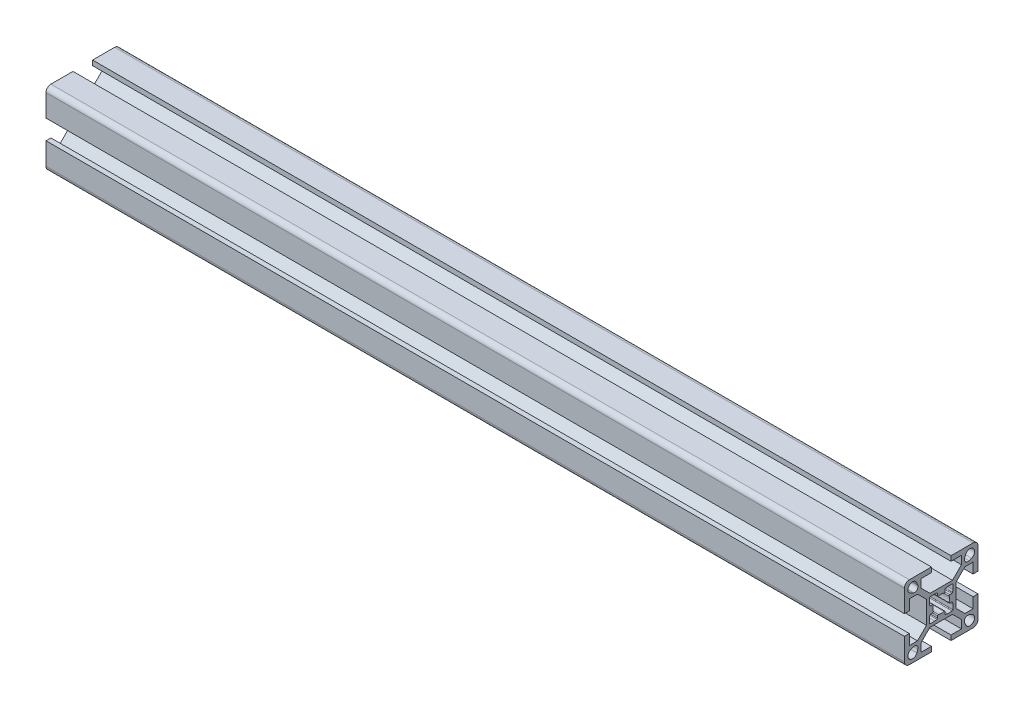
from build123d import *

# Parameters (mm, degrees)
BOSS_EXTRUDE1_DEPTH = 350


with BuildPart() as part:
    # Sketch1 → Boss-Extrude1 (new body)
    with BuildSketch(Plane(origin=(0, 0, 0), x_dir=(0, 0, -1), z_dir=(1, 0, 0))):
        with BuildLine():
            Line((-15, 13), (-15, 4))
            Line((-15, 4), (-13, 4))
            Line((-13, 4), (-13, 8.25))
            Line((-13, 8.25), (-9.664213562, 8.25))
            Line((-9.664213562, 8.25), (-6, 4.585786438))
            Line((-6, 4.585786438), (-6, -4.585786438))
            Line((-6, -4.585786438), (-9.664213562, -8.25))
            Line((-9.664213562, -8.25), (-13, -8.25))
            Line((-13, -8.25), (-13, -4))
            Line((-13, -4), (-15, -4))
            Line((-15, -4), (-15, -13))
            ThreePointArc((-15, -13), (-14.414213562, -14.414213562), (-13, -15))
            Line((-13, -15), (-4, -15))
            Line((-4, -15), (-4, -13))
            Line((-4, -13), (-8.25, -13))
            Line((-8.25, -13), (-8.25, -9.664213562))
            Line((-8.25, -9.664213562), (-4.585786438, -6))
            Line((-4.585786438, -6), (4.585786438, -6))
            Line((4.585786438, -6), (8.25, -9.664213562))
            Line((8.25, -9.664213562), (8.25, -13))
            Line((8.25, -13), (4, -13))
            Line((4, -13), (4, -15))
            Line((4, -15), (13, -15))
            ThreePointArc((13, -15), (14.414213562, -14.414213562), (15, -13))
            Line((15, -13), (15, -4))
            Line((15, -4), (13, -4))
            Line((13, -4), (13, -8.25))
            Line((13, -8.25), (9.664213562, -8.25))
            Line((9.664213562, -8.25), (6, -4.585786438))
            Line((6, -4.585786438), (6, 4.585786438))
            Line((6, 4.585786438), (9.664213562, 8.25))
            Line((9.664213562, 8.25), (13, 8.25))
            Line((13, 8.25), (13, 4))
            Line((13, 4), (15, 4))
            Line((15, 4), (15, 13))
            ThreePointArc((15, 13), (14.414213562, 14.414213562), (13, 15))
            Line((13, 15), (4, 15))
            Line((4, 15), (4, 13))
            Line((4, 13), (8.25, 13))
            Line((8.25, 13), (8.25, 9.664213562))
            Line((8.25, 9.664213562), (4.585786438, 6))
            Line((4.585786438, 6), (-4.585786438, 6))
            Line((-4.585786438, 6), (-8.25, 9.664213562))
            Line((-8.25, 9.664213562), (-8.25, 13))
            Line((-8.25, 13), (-4, 13))
            Line((-4, 13), (-4, 15))
            Line((-4, 15), (-13, 15))
            ThreePointArc((-13, 15), (-14.414213562, 14.414213562), (-15, 13))
        make_face()
        with BuildLine():
            Line((-9.539070071, 11.338915743), (-9.918883282, 12.361530981))
            ThreePointArc((-9.918883282, 12.361530981), (-13.043502884, 13.043502884), (-12.361530981, 9.918883282))
            Line((-12.361530981, 9.918883282), (-11.338915743, 9.539070071))
            ThreePointArc((-11.338915743, 9.539070071), (-9.861522369, 9.861522369), (-9.539070071, 11.338915743))
        make_face(mode=Mode.SUBTRACT)
        with BuildLine():
            Line((9.918883282, 12.361530981), (9.539070071, 11.338915743))
            ThreePointArc((9.539070071, 11.338915743), (9.861522369, 9.861522369), (11.338915743, 9.539070071))
            Line((11.338915743, 9.539070071), (12.361530981, 9.918883282))
            ThreePointArc((12.361530981, 9.918883282), (13.043502884, 13.043502884), (9.918883282, 12.361530981))
        make_face(mode=Mode.SUBTRACT)
        with BuildLine():
            Line((12.361530981, -9.918883282), (11.338915743, -9.539070071))
            ThreePointArc((11.338915743, -9.539070071), (9.861522369, -9.861522369), (9.539070071, -11.338915743))
            Line((9.539070071, -11.338915743), (9.918883282, -12.361530981))
            ThreePointArc((9.918883282, -12.361530981), (13.043502884, -13.043502884), (12.361530981, -9.918883282))
        make_face(mode=Mode.SUBTRACT)
        with BuildLine():
            Line((-11.338915743, -9.539070071), (-12.361530981, -9.918883282))
            ThreePointArc((-12.361530981, -9.918883282), (-13.043502884, -13.043502884), (-9.918883282, -12.361530981))
            Line((-9.918883282, -12.361530981), (-9.539070071, -11.338915743))
            ThreePointArc((-9.539070071, -11.338915743), (-9.861522369, -9.861522369), (-11.338915743, -9.539070071))
        make_face(mode=Mode.SUBTRACT)
        with BuildLine():
            Line((-4.8, -2.644433572), (-4.8, -4.5))
            ThreePointArc((-4.8, -4.5), (-4.712132034, -4.712132034), (-4.5, -4.8))
            Line((-4.5, -4.8), (-2.644433572, -4.8))
            ThreePointArc((-2.644433572, -4.8), (-2.615679847, -4.79861886), (-2.587190874, -4.794488155))
            Line((-2.587190874, -4.794488155), (-1.742757301, -4.630346896))
            ThreePointArc((-1.742757301, -4.630346896), (-1.568512625, -4.526682207), (-1.5, -4.335858741))
            Line((-1.5, -4.335858741), (-1.5, -3.5))
            ThreePointArc((-1.5, -3.5), (-1.374371458, -3.255879959), (-1.102702703, -3.216216216))
            ThreePointArc((-1.102702703, -3.216216216), (0, -3.4), (1.102702703, -3.216216216))
            ThreePointArc((1.102702703, -3.216216216), (1.374371458, -3.255879959), (1.5, -3.5))
            Line((1.5, -3.5), (1.5, -4.335858741))
            ThreePointArc((1.5, -4.335858741), (1.568512625, -4.526682207), (1.742757301, -4.630346896))
            Line((1.742757301, -4.630346896), (2.587190874, -4.794488155))
            ThreePointArc((2.587190874, -4.794488155), (2.615679847, -4.79861886), (2.644433572, -4.8))
            Line((2.644433572, -4.8), (4.5, -4.8))
            ThreePointArc((4.5, -4.8), (4.712132034, -4.712132034), (4.8, -4.5))
            Line((4.8, -4.5), (4.8, -2.644433572))
            ThreePointArc((4.8, -2.644433572), (4.79861886, -2.615679847), (4.794488155, -2.587190874))
            Line((4.794488155, -2.587190874), (4.630346896, -1.742757301))
            ThreePointArc((4.630346896, -1.742757301), (4.526682207, -1.568512625), (4.335858741, -1.5))
            Line((4.335858741, -1.5), (3.5, -1.5))
            ThreePointArc((3.5, -1.5), (3.255879959, -1.374371458), (3.216216216, -1.102702703))
            ThreePointArc((3.216216216, -1.102702703), (3.4, 0), (3.216216216, 1.102702703))
            ThreePointArc((3.216216216, 1.102702703), (3.255879959, 1.374371458), (3.5, 1.5))
            Line((3.5, 1.5), (4.335858741, 1.5))
            ThreePointArc((4.335858741, 1.5), (4.526682207, 1.568512625), (4.630346896, 1.742757301))
            Line((4.630346896, 1.742757301), (4.794488155, 2.587190874))
            ThreePointArc((4.794488155, 2.587190874), (4.79861886, 2.615679847), (4.8, 2.644433572))
            Line((4.8, 2.644433572), (4.8, 4.5))
            ThreePointArc((4.8, 4.5), (4.712132034, 4.712132034), (4.5, 4.8))
            Line((4.5, 4.8), (2.644433572, 4.8))
            ThreePointArc((2.644433572, 4.8), (2.615679847, 4.79861886), (2.587190874, 4.794488155))
            Line((2.587190874, 4.794488155), (1.742757301, 4.630346896))
            ThreePointArc((1.742757301, 4.630346896), (1.568512625, 4.526682207), (1.5, 4.335858741))
            Line((1.5, 4.335858741), (1.5, 3.5))
            ThreePointArc((1.5, 3.5), (1.374371458, 3.255879959), (1.102702703, 3.216216216))
            ThreePointArc((1.102702703, 3.216216216), (0, 3.4), (-1.102702703, 3.216216216))
            ThreePointArc((-1.102702703, 3.216216216), (-1.374371458, 3.255879959), (-1.5, 3.5))
            Line((-1.5, 3.5), (-1.5, 4.335858741))
            ThreePointArc((-1.5, 4.335858741), (-1.568512625, 4.526682207), (-1.742757301, 4.630346896))
            Line((-1.742757301, 4.630346896), (-2.587190874, 4.794488155))
            ThreePointArc((-2.587190874, 4.794488155), (-2.615679847, 4.79861886), (-2.644433572, 4.8))
            Line((-2.644433572, 4.8), (-4.5, 4.8))
            ThreePointArc((-4.5, 4.8), (-4.712132034, 4.712132034), (-4.8, 4.5))
            Line((-4.8, 4.5), (-4.8, 2.644433572))
            ThreePointArc((-4.8, 2.644433572), (-4.79861886, 2.615679847), (-4.794488155, 2.587190874))
            Line((-4.794488155, 2.587190874), (-4.630346896, 1.742757301))
            ThreePointArc((-4.630346896, 1.742757301), (-4.526682207, 1.568512625), (-4.335858741, 1.5))
            Line((-4.335858741, 1.5), (-3.5, 1.5))
            ThreePointArc((-3.5, 1.5), (-3.255879959, 1.374371458), (-3.216216216, 1.102702703))
            ThreePointArc((-3.216216216, 1.102702703), (-3.4, 0), (-3.216216216, -1.102702703))
            ThreePointArc((-3.216216216, -1.102702703), (-3.255879959, -1.374371458), (-3.5, -1.5))
            Line((-3.5, -1.5), (-4.335858741, -1.5))
            ThreePointArc((-4.335858741, -1.5), (-4.526682207, -1.568512625), (-4.630346896, -1.742757301))
            Line((-4.630346896, -1.742757301), (-4.794488155, -2.587190874))
            ThreePointArc((-4.794488155, -2.587190874), (-4.79861886, -2.615679847), (-4.8, -2.644433572))
        make_face(mode=Mode.SUBTRACT)
    extrude(amount=BOSS_EXTRUDE1_DEPTH)


solid = part.part
